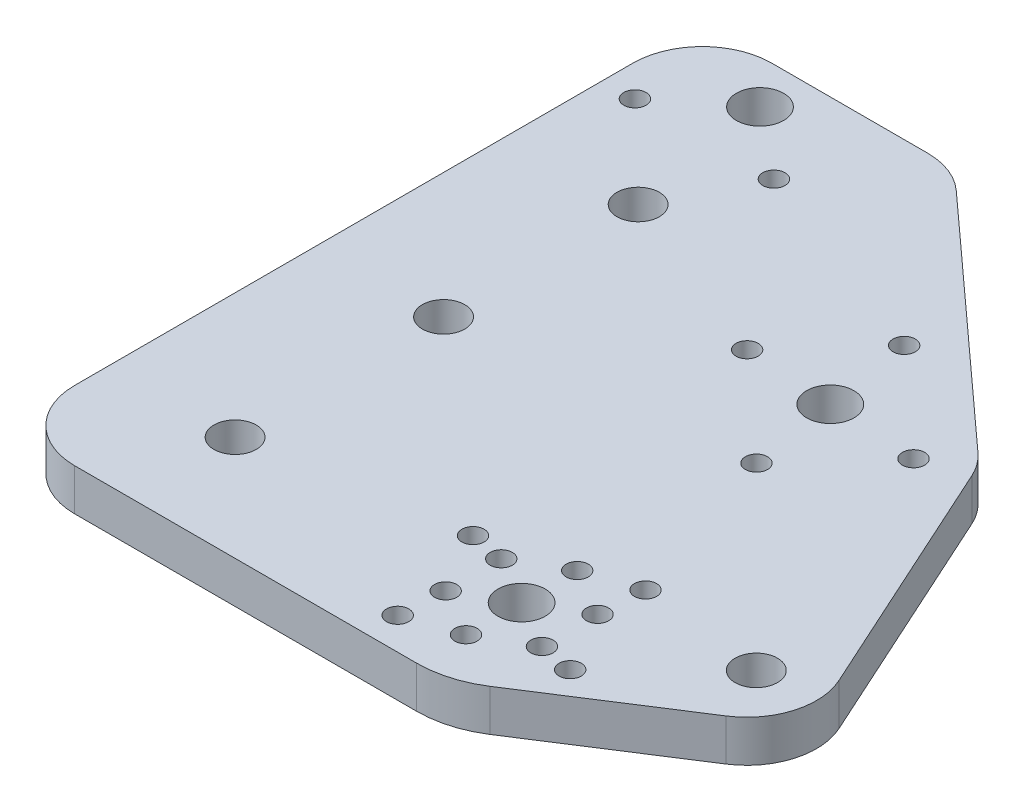
from build123d import *

# Parameters (mm, degrees)
ESBO_O1_R                = 3.4
ESBO_O1_R_2              = 1.6
ESBO_O1_R_3              = 3.05
RESSALTO_EXTRUS_O1_DEPTH = 6
ESBO_O2_R                = 3.05
CORTE_EXTRUS_O1_DEPTH    = 10
FILETE1_R                = 10


with BuildPart() as part:
    # Esboço1 → Ressalto-extrusão1 (new body)
    with BuildSketch(Plane.XZ.offset(6)):
        with BuildLine():
            ThreePointArc((148.858963728, -17.550205761), (150.213387743, -16.041631797), (151.235707119, -14.290882553))
            Line((151.235707119, -14.290882553), (167.194797105, 20.786465148))
            ThreePointArc((167.194797105, 20.786465148), (167.685761217, 27.75097204), (163.500492356, 33.339256802))
            Line((163.500492356, 33.339256802), (142.828800476, 46.629357452))
            ThreePointArc((142.828800476, 46.629357452), (138.919886426, 48.415130742), (134.666145804, 49.026919929))
            Line((134.666145804, 49.026919929), (75.43742995, 49.026919929))
            Line((75.43742995, 49.026919929), (75.43742995, -51.3))
            Line((75.43742995, -51.3), (107.856417314, -51.3))
            ThreePointArc((107.856417314, -51.3), (111.461591333, -50.627524875), (114.581887382, -48.700544058))
            Line((114.581887382, -48.700544058), (148.858963728, -17.550205761))
        make_face()
        with Locations((90.03742995, -45)):
            Circle(ESBO_O1_R, mode=Mode.SUBTRACT)
        with Locations((80.03742995, -37)):
            Circle(ESBO_O1_R_2, mode=Mode.SUBTRACT)
        with Locations((100.03742995, -37)):
            Circle(ESBO_O1_R_2, mode=Mode.SUBTRACT)
        with Locations((119.376459837, -13.805034822)):
            Circle(ESBO_O1_R_2, mode=Mode.SUBTRACT)
        with Locations((130.137211947, -25.645905315)):
            Circle(ESBO_O1_R_2, mode=Mode.SUBTRACT)
        with Locations((132.15737995, -13)):
            Circle(ESBO_O1_R, mode=Mode.SUBTRACT)
        with Locations((144.938300063, -12.194965178)):
            Circle(ESBO_O1_R_2, mode=Mode.SUBTRACT)
        with Locations((134.177547953, -0.354094685)):
            Circle(ESBO_O1_R_2, mode=Mode.SUBTRACT)
        with Locations((122.816922322, 29.075437545)):
            Circle(ESBO_O1_R_2, mode=Mode.SUBTRACT)
        with Locations((127.737942574, 29.932998956)):
            Circle(ESBO_O1_R_2, mode=Mode.SUBTRACT)
        with Locations((134.666145804, 25.932998956)):
            Circle(ESBO_O1_R_2, mode=Mode.SUBTRACT)
        with Locations((142.006279165, 23.439074893)):
            Circle(ESBO_O1_R_2, mode=Mode.SUBTRACT)
        with Locations((134.666145804, 33.932998956)):
            Circle(ESBO_O1_R, mode=Mode.SUBTRACT)
        with Locations((141.594349035, 29.932998956)):
            Circle(ESBO_O1_R_2, mode=Mode.SUBTRACT)
        with Locations((127.737942574, 37.932998956)):
            Circle(ESBO_O1_R_2, mode=Mode.SUBTRACT)
        with Locations((127.326012444, 44.426923019)):
            Circle(ESBO_O1_R_2, mode=Mode.SUBTRACT)
        with Locations((134.666145804, 41.932998956)):
            Circle(ESBO_O1_R_2, mode=Mode.SUBTRACT)
        with Locations((141.594349035, 37.932998956)):
            Circle(ESBO_O1_R_2, mode=Mode.SUBTRACT)
        with Locations((159.995303964, 25.487660186)):
            Circle(ESBO_O1_R_3, mode=Mode.SUBTRACT)
        with Locations((146.515369287, 38.790560368)):
            Circle(ESBO_O1_R_2, mode=Mode.SUBTRACT)
    extrude(amount=-RESSALTO_EXTRUS_O1_DEPTH)

    # Esboço2 → Corte-extrusão1 (cut)
    with BuildSketch(Plane.XZ.offset(6)):
        with Locations((93.43742995, 3.932998956)):
            Circle(ESBO_O2_R)
        with Locations((93.43742995, -24.067001044)):
            Circle(ESBO_O2_R)
        with Locations((93.43742995, 33.932998956)):
            Circle(ESBO_O2_R)
    extrude(amount=-CORTE_EXTRUS_O1_DEPTH, mode=Mode.SUBTRACT)

    # Filete1
    filete1_edges = [part.edges().sort_by_distance(p)[0] for p in [
        (75.43742995, -3, -51.3),
        (75.43742995, -3, 49.026919929),
    ]]
    fillet(filete1_edges, radius=FILETE1_R)


solid = part.part
